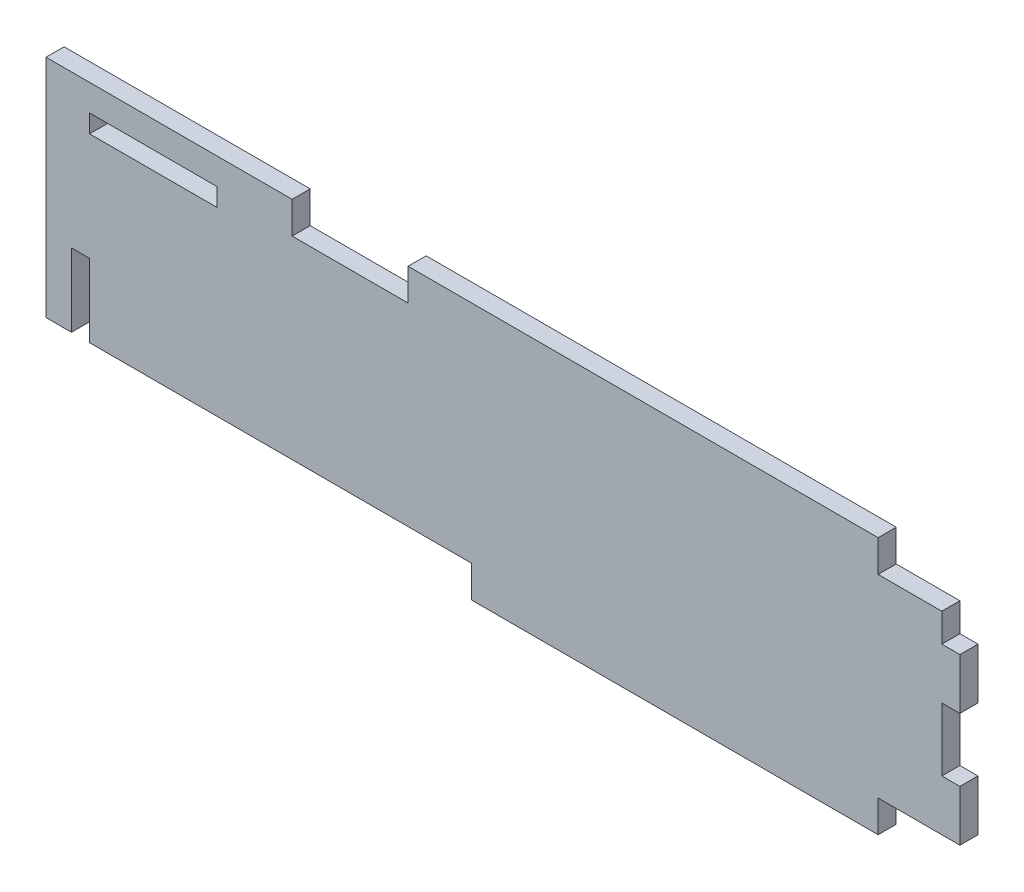
from build123d import *

# Parameters (mm, degrees)
SKETCH1_W           = 12.7
SKETCH1_H           = 1.8034
BOSS_EXTRUDE1_DEPTH = 1.8034


with BuildPart() as part:
    # Sketch1 → Boss-Extrude1 (new body)
    with BuildSketch(Plane.XY):
        Polygon((-6.35, 1.5494), (-6.35, 4.7244), (1.8034, 4.7244), (1.8034, 9.8044), (0, 9.8044), (0, 16.1036), (1.8034, 16.1036), (1.8034, 21.1836), (0, 21.1836), (0, 24.0284), (-6.35, 24.0284), (-6.35, 27.2034), (-53.213, 27.2034), (-53.213, 24.0284), (-64.77, 24.0284), (-64.77, 27.2034), (-89.3064, 27.2034), (-89.3064, 15.9639), (-89.3064, 4.7244), (-86.7664, 4.7244), (-86.7664, 12.0142), (-84.963, 12.0142), (-84.963, 4.7244), (-46.863, 4.7244), (-46.863, 1.5494), align=None)
        with Locations((-78.613, 23.6601)):
            Rectangle(SKETCH1_W, SKETCH1_H, mode=Mode.SUBTRACT)
    extrude(amount=BOSS_EXTRUDE1_DEPTH)


solid = part.part
